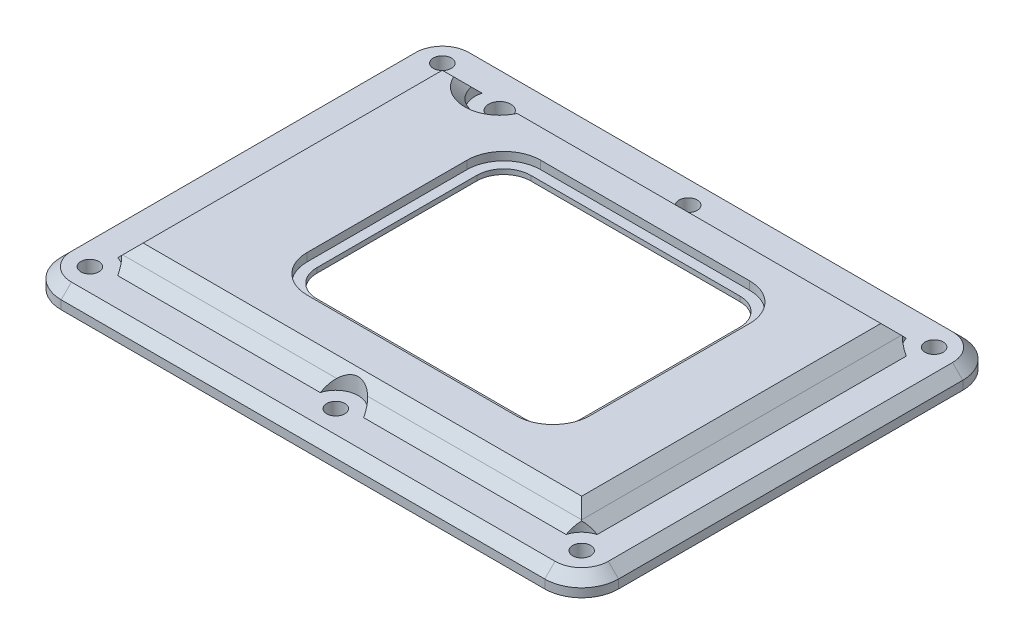
from build123d import *

# Parameters (mm, degrees)
SKETCH_1_W          = 68
SKETCH_1_H          = 51
SKETCH_1_R          = 1.1
SKETCH_1_W_2        = 52
SKETCH_1_H_2        = 35
EXTRUDE_1_DEPTH     = 2.31
SKETCH_2_W          = 56
SKETCH_2_H          = 39
SKETCH_2_W_2        = 52
SKETCH_2_H_2        = 35
EXTRUDE_2_DEPTH     = 1.5
CUT_EXTRUDE_1_REACH = 81.438
SKETCH_3_R          = 1.35
SKETCH_4_W          = 56
SKETCH_4_H          = 39
SKETCH_4_W_2        = 34.5
SKETCH_4_H_2        = 28.5
EXTRUDE_3_DEPTH     = 1
CUT_EXTRUDE_2_REACH = 81.443
SKETCH_5_R          = 3
EXTRUDE_START       = 2.5
EXTRUDE_4_DEPTH     = 2.5
EXTRUDE_5_DEPTH     = 1
FILLET_1_R          = 4.5
CHAMFER_1_SIZE      = 1.25
CUT_EXTRUDE_3_REACH = 81.443
SKETCH_9_R          = 2.75
EXTRUDE_6_DEPTH     = 0.6


with BuildPart() as part:
    # 草图1 → 凸台-拉伸1 (new body)
    with BuildSketch(Plane(origin=(0, 0, 0), x_dir=(1, 0, 0), z_dir=(0, 1, 0))):
        with Locations((30, -21.5)):
            Rectangle(SKETCH_1_W, SKETCH_1_H)
        with Locations(Location((0, 0, 0), (0, 0, 270))):
            Circle(SKETCH_1_R, mode=Mode.SUBTRACT)
        with Locations(Location((60, 0, 0), (0, 0, 270))):
            Circle(SKETCH_1_R, mode=Mode.SUBTRACT)
        with Locations(Location((30, 0, 0), (0, 0, 270))):
            Circle(SKETCH_1_R, mode=Mode.SUBTRACT)
        with Locations(Location((0, -43, 0), (0, 0, 270))):
            Circle(SKETCH_1_R, mode=Mode.SUBTRACT)
        with Locations(Location((60, -43, 0), (0, 0, 270))):
            Circle(SKETCH_1_R, mode=Mode.SUBTRACT)
        with Locations(Location((30, -43, 0), (0, 0, 270))):
            Circle(SKETCH_1_R, mode=Mode.SUBTRACT)
        with Locations((30, -21.5)):
            Rectangle(SKETCH_1_W_2, SKETCH_1_H_2, mode=Mode.SUBTRACT)
    extrude(amount=EXTRUDE_1_DEPTH)

    # 草图2 → 凸台-拉伸2 (add)
    with BuildSketch(Plane(origin=(0, 2.31, 0), x_dir=(1, 0, 0), z_dir=(0, 1, 0))):
        with Locations((30, -21.5)):
            Rectangle(SKETCH_2_W, SKETCH_2_H)
        with Locations((30, -21.5)):
            Rectangle(SKETCH_2_W_2, SKETCH_2_H_2, mode=Mode.SUBTRACT)
    extrude(amount=EXTRUDE_2_DEPTH)

    # 草图3 → 切除-拉伸1 (cut, up to next)
    with BuildSketch(Plane(origin=(0, 2.31, 0), x_dir=(1, 0, 0), z_dir=(0, 1, 0)), mode=Mode.PRIVATE) as cut_extrude_1_sk1:
        with Locations(Location((8.5, -1.5, 0), (0, 0, 270))):
            Circle(SKETCH_3_R)
    cut_extrude_1_tool1 = extrude(cut_extrude_1_sk1.sketch, amount=-CUT_EXTRUDE_1_REACH, mode=Mode.PRIVATE) & part.part
    add(cut_extrude_1_tool1.solids().sort_by_distance((8.5, 2.31, 1.5))[0], mode=Mode.SUBTRACT)

    # 草图4 → 凸台-拉伸3 (add)
    with BuildSketch(Plane(origin=(0, 3.81, 0), x_dir=(1, 0, 0), z_dir=(0, 1, 0))):
        with Locations((30, -21.5)):
            Rectangle(SKETCH_4_W, SKETCH_4_H)
        with Locations((31.5, -21)):
            Rectangle(SKETCH_4_W_2, SKETCH_4_H_2, mode=Mode.SUBTRACT)
    extrude(amount=EXTRUDE_3_DEPTH)

    # 草图5 → 切除-拉伸2 (cut, up to next)
    with BuildSketch(Plane(origin=(0, 2.31, 0), x_dir=(1, 0, 0), z_dir=(0, 1, 0)), mode=Mode.PRIVATE) as cut_extrude_2_sk1:
        with Locations((8.5, -1.5)):
            Circle(SKETCH_5_R)
    cut_extrude_2_tool1 = extrude(cut_extrude_2_sk1.sketch, amount=CUT_EXTRUDE_2_REACH, mode=Mode.PRIVATE) & part.part
    add(cut_extrude_2_tool1.solids().sort_by_distance((8.5, 2.31, 1.5))[0], mode=Mode.SUBTRACT)

    # 草图6 → 凸台-拉伸4 (add)
    with BuildSketch(Plane.XZ.offset(-3.81).offset(EXTRUDE_START)):
        with BuildLine():
            Line((5.377501001, 4), (6.841687605, 4))
            ThreePointArc((6.841687605, 4), (8.5, 4.5), (10.158312395, 4))
            Line((10.158312395, 4), (11.622498999, 4))
            ThreePointArc((11.622498999, 4), (8.5, 5.5), (5.377501001, 4))
        make_face()
    extrude(amount=-EXTRUDE_4_DEPTH)

    # 草图7 → 凸台-拉伸5 (add)
    with BuildSketch(Plane.XZ.offset(-1.31)):
        with BuildLine():
            Line((5.377501001, 4), (11.622498999, 4))
            ThreePointArc((11.622498999, 4), (8.5, 5.5), (5.377501001, 4))
        make_face()
    extrude(amount=-EXTRUDE_5_DEPTH)

    # 圆角1
    fillet_1_edges = [part.edges().sort_by_distance(p)[0] for p in [
        (-4, 1.155, -4),
        (64, 1.155, -4),
        (64, 1.155, 47),
        (-4, 1.155, 47),
        (14.25, 4.31, 35.25),
        (48.75, 4.31, 35.25),
        (48.75, 4.31, 6.75),
        (14.25, 4.31, 6.75),
    ]]
    fillet(fillet_1_edges, radius=FILLET_1_R)

    # 倒角1
    # the kernel refuses this chamfer: 1.25 mm, written as the material it adds along each edge
    with BuildSketch(Plane(origin=(2, 2.31, 2), x_dir=(0, 0, -1), z_dir=(1, 0, 0))) as chamfer_1_piece_1_section:
        Polygon((CHAMFER_1_SIZE, 0), (0, CHAMFER_1_SIZE), (0, 0), align=None)
    chamfer_1_piece_1 = extrude(amount=6.756563843, mode=Mode.PRIVATE)
    chamfer_1_piece_1 = chamfer_1_piece_1 - Plane(origin=(8.5, 2.31, 1.5), x_dir=(1, 0, 0), z_dir=(0, -1, 0)) * Cylinder(3, 19, mode=Mode.PRIVATE)
    add(chamfer_1_piece_1)
    with BuildSketch(Plane(origin=(8.243436157, 2.31, 2), x_dir=(0, 0, -1), z_dir=(1, 0, 0))) as chamfer_1_piece_2_section:
        Polygon((CHAMFER_1_SIZE, 0), (0, CHAMFER_1_SIZE), (0, 0), align=None)
    chamfer_1_piece_2 = extrude(amount=49.756563843, mode=Mode.PRIVATE)
    chamfer_1_piece_2 = chamfer_1_piece_2 - Plane(origin=(30, 2.31, 0), x_dir=(0, 0, 1), z_dir=(0, -1, 0)) * Cylinder(1.1, 105, mode=Mode.PRIVATE)
    chamfer_1_piece_2 = chamfer_1_piece_2 - Plane(origin=(8.5, 2.31, 1.5), x_dir=(1, 0, 0), z_dir=(0, -1, 0)) * Cylinder(3, 105, mode=Mode.PRIVATE)
    add(chamfer_1_piece_2)
    with BuildSketch(Plane(origin=(2, 2.31, 41), x_dir=(-1, 0, 0), z_dir=(0, 0, -1)), Plane(origin=(58, 2.31, 2), x_dir=(1, 0, 0), z_dir=(0, 0, 1))) as chamfer_1_piece_3:
        Polygon((CHAMFER_1_SIZE, 0), (0, CHAMFER_1_SIZE), (0, 0), align=None)
    extrude(amount=39)
    with BuildSketch(Plane(origin=(58, 2.31, 41), x_dir=(0, 0, 1), z_dir=(-1, 0, 0))) as chamfer_1_piece_4_section:
        Polygon((CHAMFER_1_SIZE, 0), (0, CHAMFER_1_SIZE), (0, 0), align=None)
    chamfer_1_piece_4 = extrude(amount=56, mode=Mode.PRIVATE)
    chamfer_1_piece_4 = chamfer_1_piece_4 - Plane(origin=(30, 2.31, 43), x_dir=(0, 0, 1), z_dir=(0, -1, 0)) * Cylinder(1.1, 118, mode=Mode.PRIVATE)
    add(chamfer_1_piece_4)
    with BuildSketch(Plane(origin=(-1.214603735, 2.31, 2), x_dir=(0, 0, -1), z_dir=(1, 0, 0))) as chamfer_1_piece_5a_section:
        Polygon((CHAMFER_1_SIZE, 0), (0, CHAMFER_1_SIZE), (0, 0), align=None)
    chamfer_1_piece_5a = extrude(amount=9.971167578, mode=Mode.PRIVATE)
    chamfer_1_piece_5a = chamfer_1_piece_5a - Plane(origin=(0, 2.31, 0), x_dir=(0, 0, 1), z_dir=(0, -1, 0)) * Cylinder(1.1, 25, mode=Mode.PRIVATE)
    chamfer_1_piece_5a = split(chamfer_1_piece_5a, bisect_by=Plane(origin=(2, 2.31, 2), z_dir=(-1, 0, 0)), keep=Keep.TOP, mode=Mode.PRIVATE)
    with BuildSketch(Plane(origin=(2, 2.31, 41), x_dir=(-1, 0, 0), z_dir=(0, 0, -1))) as chamfer_1_piece_5b_section:
        Polygon((CHAMFER_1_SIZE, 0), (0, CHAMFER_1_SIZE), (0, 0), align=None)
    chamfer_1_piece_5b = extrude(amount=42.214603735, mode=Mode.PRIVATE)
    chamfer_1_piece_5b = chamfer_1_piece_5b - Plane(origin=(0, 2.31, 0), x_dir=(0, 0, 1), z_dir=(0, -1, 0)) * Cylinder(1.1, 90, mode=Mode.PRIVATE)
    chamfer_1_piece_5b = split(chamfer_1_piece_5b, bisect_by=Plane(origin=(2, 2.31, 2), z_dir=(0, 0, -1)), keep=Keep.TOP, mode=Mode.PRIVATE)
    chamfer_1_piece_5 = chamfer_1_piece_5a & chamfer_1_piece_5b
    add(chamfer_1_piece_5)
    with BuildSketch(Plane(origin=(58, 2.31, -1.214603735), x_dir=(1, 0, 0), z_dir=(0, 0, 1))) as chamfer_1_piece_6a_section:
        Polygon((CHAMFER_1_SIZE, 0), (0, CHAMFER_1_SIZE), (0, 0), align=None)
    chamfer_1_piece_6a = extrude(amount=42.214603735, mode=Mode.PRIVATE)
    chamfer_1_piece_6a = chamfer_1_piece_6a - Plane(origin=(60, 2.31, 0), x_dir=(0, 0, 1), z_dir=(0, -1, 0)) * Cylinder(1.1, 90, mode=Mode.PRIVATE)
    chamfer_1_piece_6a = split(chamfer_1_piece_6a, bisect_by=Plane(origin=(58, 2.31, 2), z_dir=(0, 0, -1)), keep=Keep.TOP, mode=Mode.PRIVATE)
    with BuildSketch(Plane(origin=(8.243436157, 2.31, 2), x_dir=(0, 0, -1), z_dir=(1, 0, 0))) as chamfer_1_piece_6b_section:
        Polygon((CHAMFER_1_SIZE, 0), (0, CHAMFER_1_SIZE), (0, 0), align=None)
    chamfer_1_piece_6b = extrude(amount=52.971167578, mode=Mode.PRIVATE)
    chamfer_1_piece_6b = chamfer_1_piece_6b - Plane(origin=(60, 2.31, 0), x_dir=(0, 0, 1), z_dir=(0, -1, 0)) * Cylinder(1.1, 111, mode=Mode.PRIVATE)
    chamfer_1_piece_6b = split(chamfer_1_piece_6b, bisect_by=Plane(origin=(58, 2.31, 2), z_dir=(1, 0, 0)), keep=Keep.TOP, mode=Mode.PRIVATE)
    chamfer_1_piece_6 = chamfer_1_piece_6a & chamfer_1_piece_6b
    add(chamfer_1_piece_6)
    with BuildSketch(Plane(origin=(2, 2.31, 44.214603735), x_dir=(-1, 0, 0), z_dir=(0, 0, -1))) as chamfer_1_piece_7a_section:
        Polygon((CHAMFER_1_SIZE, 0), (0, CHAMFER_1_SIZE), (0, 0), align=None)
    chamfer_1_piece_7a = extrude(amount=42.214603735, mode=Mode.PRIVATE)
    chamfer_1_piece_7a = chamfer_1_piece_7a - Plane(origin=(0, 2.31, 43), x_dir=(0, 0, 1), z_dir=(0, -1, 0)) * Cylinder(1.1, 90, mode=Mode.PRIVATE)
    chamfer_1_piece_7a = split(chamfer_1_piece_7a, bisect_by=Plane(origin=(2, 2.31, 41), z_dir=(0, 0, 1)), keep=Keep.TOP, mode=Mode.PRIVATE)
    with BuildSketch(Plane(origin=(58, 2.31, 41), x_dir=(0, 0, 1), z_dir=(-1, 0, 0))) as chamfer_1_piece_7b_section:
        Polygon((CHAMFER_1_SIZE, 0), (0, CHAMFER_1_SIZE), (0, 0), align=None)
    chamfer_1_piece_7b = extrude(amount=59.214603735, mode=Mode.PRIVATE)
    chamfer_1_piece_7b = chamfer_1_piece_7b - Plane(origin=(0, 2.31, 43), x_dir=(0, 0, 1), z_dir=(0, -1, 0)) * Cylinder(1.1, 124, mode=Mode.PRIVATE)
    chamfer_1_piece_7b = split(chamfer_1_piece_7b, bisect_by=Plane(origin=(2, 2.31, 41), z_dir=(-1, 0, 0)), keep=Keep.TOP, mode=Mode.PRIVATE)
    chamfer_1_piece_7 = chamfer_1_piece_7a & chamfer_1_piece_7b
    add(chamfer_1_piece_7)
    with BuildSketch(Plane(origin=(61.214603735, 2.31, 41), x_dir=(0, 0, 1), z_dir=(-1, 0, 0))) as chamfer_1_piece_8a_section:
        Polygon((CHAMFER_1_SIZE, 0), (0, CHAMFER_1_SIZE), (0, 0), align=None)
    chamfer_1_piece_8a = extrude(amount=59.214603735, mode=Mode.PRIVATE)
    chamfer_1_piece_8a = chamfer_1_piece_8a - Plane(origin=(60, 2.31, 43), x_dir=(0, 0, 1), z_dir=(0, -1, 0)) * Cylinder(1.1, 124, mode=Mode.PRIVATE)
    chamfer_1_piece_8a = split(chamfer_1_piece_8a, bisect_by=Plane(origin=(58, 2.31, 41), z_dir=(1, 0, 0)), keep=Keep.TOP, mode=Mode.PRIVATE)
    with BuildSketch(Plane(origin=(58, 2.31, 2), x_dir=(1, 0, 0), z_dir=(0, 0, 1))) as chamfer_1_piece_8b_section:
        Polygon((CHAMFER_1_SIZE, 0), (0, CHAMFER_1_SIZE), (0, 0), align=None)
    chamfer_1_piece_8b = extrude(amount=42.214603735, mode=Mode.PRIVATE)
    chamfer_1_piece_8b = chamfer_1_piece_8b - Plane(origin=(60, 2.31, 43), x_dir=(0, 0, 1), z_dir=(0, -1, 0)) * Cylinder(1.1, 90, mode=Mode.PRIVATE)
    chamfer_1_piece_8b = split(chamfer_1_piece_8b, bisect_by=Plane(origin=(58, 2.31, 41), z_dir=(0, 0, 1)), keep=Keep.TOP, mode=Mode.PRIVATE)
    chamfer_1_piece_8 = chamfer_1_piece_8a & chamfer_1_piece_8b
    add(chamfer_1_piece_8)
    # the kernel refuses this chamfer: 1.25 mm, written as the material it takes off along each edge
    with BuildSketch(Plane(origin=(58, 4.81, 44.214603735), x_dir=(-1, 0, 0), z_dir=(0, 0, -1)), Plane(origin=(2, 4.81, -1.214603735), x_dir=(1, 0, 0), z_dir=(0, 0, 1))) as chamfer_1_2_piece_1:
        Polygon((CHAMFER_1_SIZE, 0), (0, -CHAMFER_1_SIZE), (0, 0), align=None)
    extrude(amount=45.42920747, mode=Mode.SUBTRACT)
    with BuildSketch(Plane(origin=(-1.214603735, 4.81, 41), x_dir=(0, -1, 0), z_dir=(1, 0, 0))) as chamfer_1_2_piece_2:
        Polygon((CHAMFER_1_SIZE, 0), (0, CHAMFER_1_SIZE), (0, 0), align=None)
    extrude(amount=62.42920747, mode=Mode.SUBTRACT)
    with BuildSketch(Plane(origin=(8.756563843, 4.81, 2), x_dir=(0, 0, 1), z_dir=(-1, 0, 0))) as chamfer_1_2_piece_3:
        Polygon((CHAMFER_1_SIZE, 0), (0, -CHAMFER_1_SIZE), (0, 0), align=None)
    extrude(amount=9.971167578, mode=Mode.SUBTRACT)
    with BuildSketch(Plane(origin=(61.214603735, 4.81, 2), x_dir=(0, 0, 1), z_dir=(-1, 0, 0))) as chamfer_1_2_piece_4:
        Polygon((CHAMFER_1_SIZE, 0), (0, -CHAMFER_1_SIZE), (0, 0), align=None)
    extrude(amount=52.971167578, mode=Mode.SUBTRACT)
    with BuildSketch(Plane(origin=(8.5, 4.81, 1.5), x_dir=(0.6173224971871656, 0, -0.7867101972560174), z_dir=(-0.7867101972560174, 0, -0.6173224971871656))) as chamfer_1_2_piece_5:
        Polygon((3 + CHAMFER_1_SIZE, 0), (3, CHAMFER_1_SIZE), (3, 0), align=None)
    revolve(axis=Axis((8.5, 4.81, 1.5), (0, -1, 0)), revolution_arc=283.758256834, mode=Mode.SUBTRACT)
    with BuildSketch(Plane(origin=(64, 2.31, 0.5), x_dir=(-1, 0, 0), z_dir=(0, 0, 1)), Plane(origin=(-4, 2.31, 42.5), x_dir=(1, 0, 0), z_dir=(0, 0, -1))) as chamfer_1_2_piece_6:
        Polygon((CHAMFER_1_SIZE, 0), (0, CHAMFER_1_SIZE), (0, 0), align=None)
    extrude(amount=42, mode=Mode.SUBTRACT)
    with BuildSketch(Plane(origin=(59.5, 2.31, 0.5), x_dir=(0, 0, -1), z_dir=(-1, 0, 0))) as chamfer_1_2_piece_7:
        Polygon((4.5 - CHAMFER_1_SIZE, 0), (4.5, CHAMFER_1_SIZE), (4.5, 0), align=None)
    revolve(axis=Axis((59.5, 2.31, 0.5), (0, -1, 0)), revolution_arc=90, mode=Mode.SUBTRACT)
    with BuildSketch(Plane(origin=(59.5, 2.31, 42.5), x_dir=(0, 0, 1), z_dir=(-1, 0, 0))) as chamfer_1_2_piece_8:
        Polygon((4.5 - CHAMFER_1_SIZE, 0), (4.5, -CHAMFER_1_SIZE), (4.5, 0), align=None)
    revolve(axis=Axis((59.5, 2.31, 42.5), (0, 1, 0)), revolution_arc=90, mode=Mode.SUBTRACT)
    with BuildSketch(Plane(origin=(0.5, 2.31, -4), x_dir=(0, -1, 0), z_dir=(1, 0, 0))) as chamfer_1_2_piece_9:
        Polygon((CHAMFER_1_SIZE, 0), (0, -CHAMFER_1_SIZE), (0, 0), align=None)
    extrude(amount=59, mode=Mode.SUBTRACT)
    with BuildSketch(Plane(origin=(59.5, 2.31, 47), x_dir=(0, 0, -1), z_dir=(-1, 0, 0))) as chamfer_1_2_piece_10:
        Polygon((CHAMFER_1_SIZE, 0), (0, CHAMFER_1_SIZE), (0, 0), align=None)
    extrude(amount=59, mode=Mode.SUBTRACT)
    with BuildSketch(Plane(origin=(0.5, 2.31, 0.5), x_dir=(0, 0, -1), z_dir=(1, 0, 0))) as chamfer_1_2_piece_11:
        Polygon((4.5 - CHAMFER_1_SIZE, 0), (4.5, -CHAMFER_1_SIZE), (4.5, 0), align=None)
    revolve(axis=Axis((0.5, 2.31, 0.5), (0, 1, 0)), revolution_arc=90, mode=Mode.SUBTRACT)
    with BuildSketch(Plane(origin=(0.5, 2.31, 42.5), x_dir=(0, 0, 1), z_dir=(1, 0, 0))) as chamfer_1_2_piece_12:
        Polygon((4.5 - CHAMFER_1_SIZE, 0), (4.5, CHAMFER_1_SIZE), (4.5, 0), align=None)
    revolve(axis=Axis((0.5, 2.31, 42.5), (0, -1, 0)), revolution_arc=90, mode=Mode.SUBTRACT)

    # 草图9 → 切除-拉伸3 (cut, up to next)
    with BuildSketch(Plane(origin=(0, 2.31, 0), x_dir=(1, 0, 0), z_dir=(0, 1, 0)), mode=Mode.PRIVATE) as cut_extrude_3_sk1:
        Circle(SKETCH_9_R)
    cut_extrude_3_tool1 = extrude(cut_extrude_3_sk1.sketch, amount=CUT_EXTRUDE_3_REACH, mode=Mode.PRIVATE) & part.part
    # 草图9 → 切除-拉伸3 (cut, up to next)
    with BuildSketch(Plane(origin=(0, 2.31, 0), x_dir=(1, 0, 0), z_dir=(0, 1, 0)), mode=Mode.PRIVATE) as cut_extrude_3_sk2:
        with Locations((30, 0)):
            Circle(SKETCH_9_R)
    cut_extrude_3_tool2 = extrude(cut_extrude_3_sk2.sketch, amount=CUT_EXTRUDE_3_REACH, mode=Mode.PRIVATE) & part.part
    # 草图9 → 切除-拉伸3 (cut, up to next)
    with BuildSketch(Plane(origin=(0, 2.31, 0), x_dir=(1, 0, 0), z_dir=(0, 1, 0)), mode=Mode.PRIVATE) as cut_extrude_3_sk3:
        with Locations((60, 0)):
            Circle(SKETCH_9_R)
    cut_extrude_3_tool3 = extrude(cut_extrude_3_sk3.sketch, amount=CUT_EXTRUDE_3_REACH, mode=Mode.PRIVATE) & part.part
    # 草图9 → 切除-拉伸3 (cut, up to next)
    with BuildSketch(Plane(origin=(0, 2.31, 0), x_dir=(1, 0, 0), z_dir=(0, 1, 0)), mode=Mode.PRIVATE) as cut_extrude_3_sk4:
        with Locations((60, -43)):
            Circle(SKETCH_9_R)
    cut_extrude_3_tool4 = extrude(cut_extrude_3_sk4.sketch, amount=CUT_EXTRUDE_3_REACH, mode=Mode.PRIVATE) & part.part
    # 草图9 → 切除-拉伸3 (cut, up to next)
    with BuildSketch(Plane(origin=(0, 2.31, 0), x_dir=(1, 0, 0), z_dir=(0, 1, 0)), mode=Mode.PRIVATE) as cut_extrude_3_sk5:
        with Locations((30, -43)):
            Circle(SKETCH_9_R)
    cut_extrude_3_tool5 = extrude(cut_extrude_3_sk5.sketch, amount=CUT_EXTRUDE_3_REACH, mode=Mode.PRIVATE) & part.part
    # 草图9 → 切除-拉伸3 (cut, up to next)
    with BuildSketch(Plane(origin=(0, 2.31, 0), x_dir=(1, 0, 0), z_dir=(0, 1, 0)), mode=Mode.PRIVATE) as cut_extrude_3_sk6:
        with Locations((0, -43)):
            Circle(SKETCH_9_R)
    cut_extrude_3_tool6 = extrude(cut_extrude_3_sk6.sketch, amount=CUT_EXTRUDE_3_REACH, mode=Mode.PRIVATE) & part.part
    add(cut_extrude_3_tool1.solids().sort_by_distance((0, 2.31, 0))[0], mode=Mode.SUBTRACT)
    add(cut_extrude_3_tool2.solids().sort_by_distance((30, 2.31, 0))[0], mode=Mode.SUBTRACT)
    add(cut_extrude_3_tool3.solids().sort_by_distance((60, 2.31, 0))[0], mode=Mode.SUBTRACT)
    add(cut_extrude_3_tool4.solids().sort_by_distance((60, 2.31, 43))[0], mode=Mode.SUBTRACT)
    add(cut_extrude_3_tool5.solids().sort_by_distance((30, 2.31, 43))[0], mode=Mode.SUBTRACT)
    add(cut_extrude_3_tool6.solids().sort_by_distance((0, 2.31, 43))[0], mode=Mode.SUBTRACT)

    # 草图10 → 凸台-拉伸6 (add)
    with BuildSketch(Plane.XZ.offset(-3.81)):
        with BuildLine():
            Line((44.25, 37.25), (18.75, 37.25))
            ThreePointArc((18.75, 37.25), (14.153805922, 35.346194078), (12.25, 30.75))
            Line((12.25, 30.75), (12.25, 11.25))
            ThreePointArc((12.25, 11.25), (14.153805922, 6.653805922), (18.75, 4.75))
            Line((18.75, 4.75), (44.25, 4.75))
            ThreePointArc((44.25, 4.75), (48.846194078, 6.653805922), (50.75, 11.25))
            Line((50.75, 11.25), (50.75, 30.75))
            ThreePointArc((50.75, 30.75), (48.846194078, 35.346194078), (44.25, 37.25))
        make_face()
        with BuildLine():
            Line((47.55, 11.25), (47.55, 30.75))
            ThreePointArc((47.55, 30.75), (46.583452378, 33.083452378), (44.25, 34.05))
            Line((44.25, 34.05), (18.75, 34.05))
            ThreePointArc((18.75, 34.05), (16.416547622, 33.083452378), (15.45, 30.75))
            Line((15.45, 30.75), (15.45, 11.25))
            ThreePointArc((15.45, 11.25), (16.416547622, 8.916547622), (18.75, 7.95))
            Line((18.75, 7.95), (44.25, 7.95))
            ThreePointArc((44.25, 7.95), (46.583452378, 8.916547622), (47.55, 11.25))
        make_face(mode=Mode.SUBTRACT)
    extrude(amount=EXTRUDE_6_DEPTH)


solid = part.part
